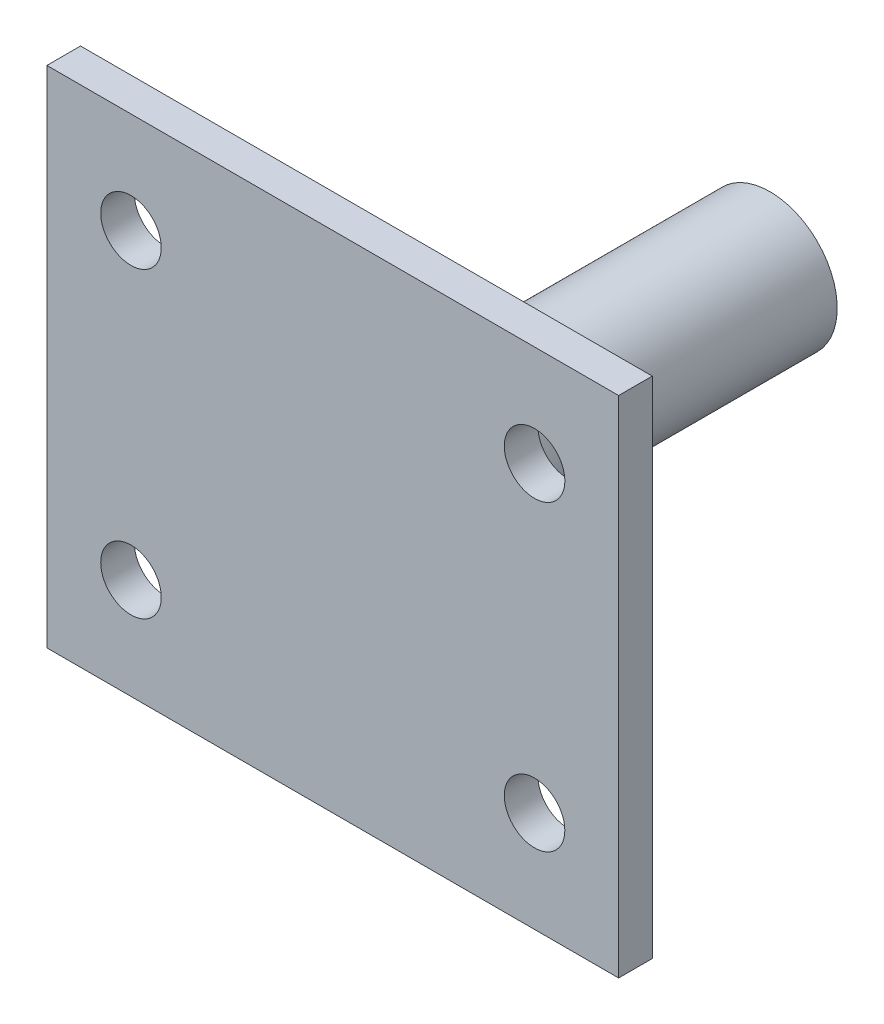
from build123d import *

# Parameters (mm, degrees)
SKETCH1_W           = 34
SKETCH1_H           = 30
SKETCH1_R           = 1.8
BOSS_EXTRUDE1_DEPTH = 2
SCALE1_SCALE        = 1.25
SKETCH2_R           = 5
BOSS_EXTRUDE2_DEPTH = 30


with BuildPart() as part:
    # Sketch1 → Boss-Extrude1 (new body)
    with BuildSketch(Plane.XY):
        Rectangle(SKETCH1_W, SKETCH1_H)
        with Locations((-12, 9)):
            Circle(SKETCH1_R, mode=Mode.SUBTRACT)
        with Locations((12, 9)):
            Circle(SKETCH1_R, mode=Mode.SUBTRACT)
        with Locations((12, -9)):
            Circle(SKETCH1_R, mode=Mode.SUBTRACT)
        with Locations((-12, -9)):
            Circle(SKETCH1_R, mode=Mode.SUBTRACT)
    extrude(amount=BOSS_EXTRUDE1_DEPTH)


with BuildPart() as part_1:
    # Scale1: scaled about (0, 0, 1)
    add(part.part.scale(SCALE1_SCALE).moved(Location((0, 0, -0.25))))

    # Sketch2 → Boss-Extrude2 (add)
    with BuildSketch(Plane(origin=(0, 0, -0.25), x_dir=(-1, 0, 0), z_dir=(0, 0, -1))):
        Circle(SKETCH2_R)
    extrude(amount=BOSS_EXTRUDE2_DEPTH)


solid = part_1.part
